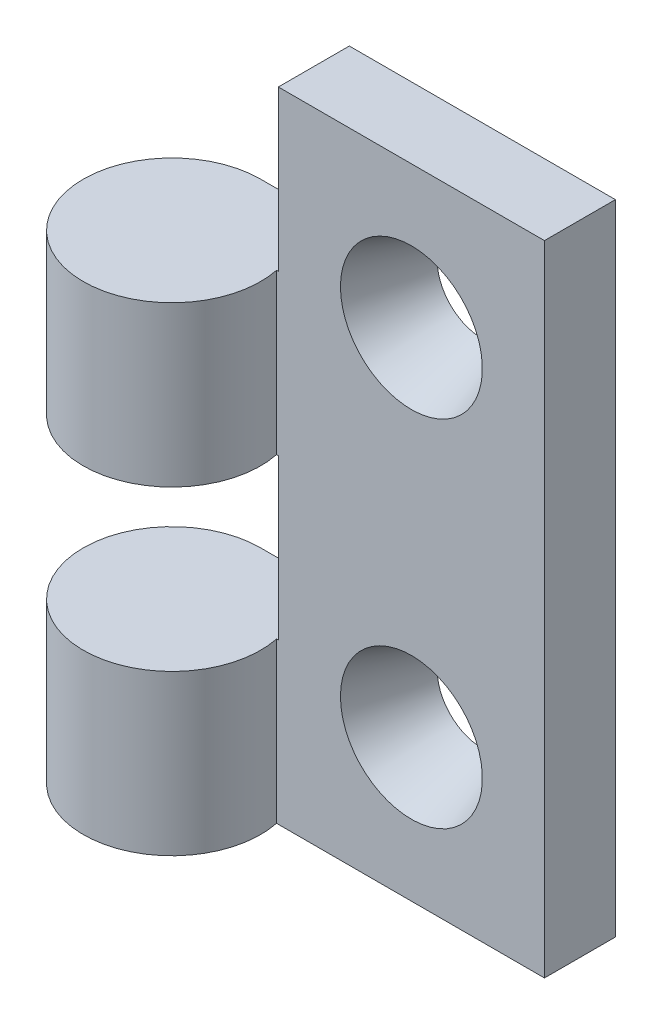
from build123d import *

# Parameters (mm, degrees)
SKETCH3_W           = 36
SKETCH3_H           = 20
SKETCH3_R           = 2.5
BOSS_EXTRUDE2_DEPTH = 4
SKETCH4_R           = 5
BOSS_EXTRUDE3_DEPTH = 36
CHAMFER1_SIZE       = 1.5
CHAMFER1_SIZE_2     = 4.121216129
SKETCH5_W           = 10
SKETCH5_H           = 9
CUT_EXTRUDE2_DEPTH  = 45.955533586


with BuildPart() as part:
    # Sketch3 → Boss-Extrude2 (new body)
    with BuildSketch(Plane(origin=(0, 0, 0), x_dir=(0, 1, 0), z_dir=(0, 0, 1))):
        with Locations((18, 10)):
            Rectangle(SKETCH3_W, SKETCH3_H)
        with Locations(Location((8, 7.5, 0), (0, 0, 270))):
            Circle(SKETCH3_R, mode=Mode.SUBTRACT)
        with Locations(Location((28, 7.5, 0), (0, 0, 270))):
            Circle(SKETCH3_R, mode=Mode.SUBTRACT)
    extrude(amount=BOSS_EXTRUDE2_DEPTH)

    # Sketch4 → Boss-Extrude3 (add, through all)
    with BuildSketch(Plane.XZ):
        with Locations((-20, 5)):
            Circle(SKETCH4_R)
    extrude(amount=-BOSS_EXTRUDE3_DEPTH)

    # Chamfer1
    # the kernel refuses this chamfer: 4.121216129, 1.5 mm, written as the material it takes off along each edge
    with BuildSketch(Plane(origin=(-7.5, 28, 4), x_dir=(1, 0, 0), z_dir=(0, -1, 0))) as chamfer1_piece_1:
        Polygon((2.5 + CHAMFER1_SIZE, 0), (2.5, -CHAMFER1_SIZE_2), (2.5, 0), align=None)
    revolve(axis=Axis((-7.5, 28, 4), (0, 0, 1)), mode=Mode.SUBTRACT)
    with BuildSketch(Plane(origin=(-7.5, 8, 4), x_dir=(1, 0, 0), z_dir=(0, -1, 0))) as chamfer1_piece_2:
        Polygon((2.5 + CHAMFER1_SIZE, 0), (2.5, -CHAMFER1_SIZE_2), (2.5, 0), align=None)
    revolve(axis=Axis((-7.5, 8, 4), (0, 0, 1)), mode=Mode.SUBTRACT)

    # Sketch5 → Cut-Extrude2 (cut, through all)
    with BuildSketch(Plane(origin=(0, 0, 0), x_dir=(1, 0, 0), z_dir=(0, 0, -1))):
        with Locations((-20, -13.5)):
            Rectangle(SKETCH5_W, SKETCH5_H)
        with Locations((-20, -31.5)):
            Rectangle(SKETCH5_W, SKETCH5_H)
    extrude(amount=-CUT_EXTRUDE2_DEPTH, mode=Mode.SUBTRACT)


solid = part.part
